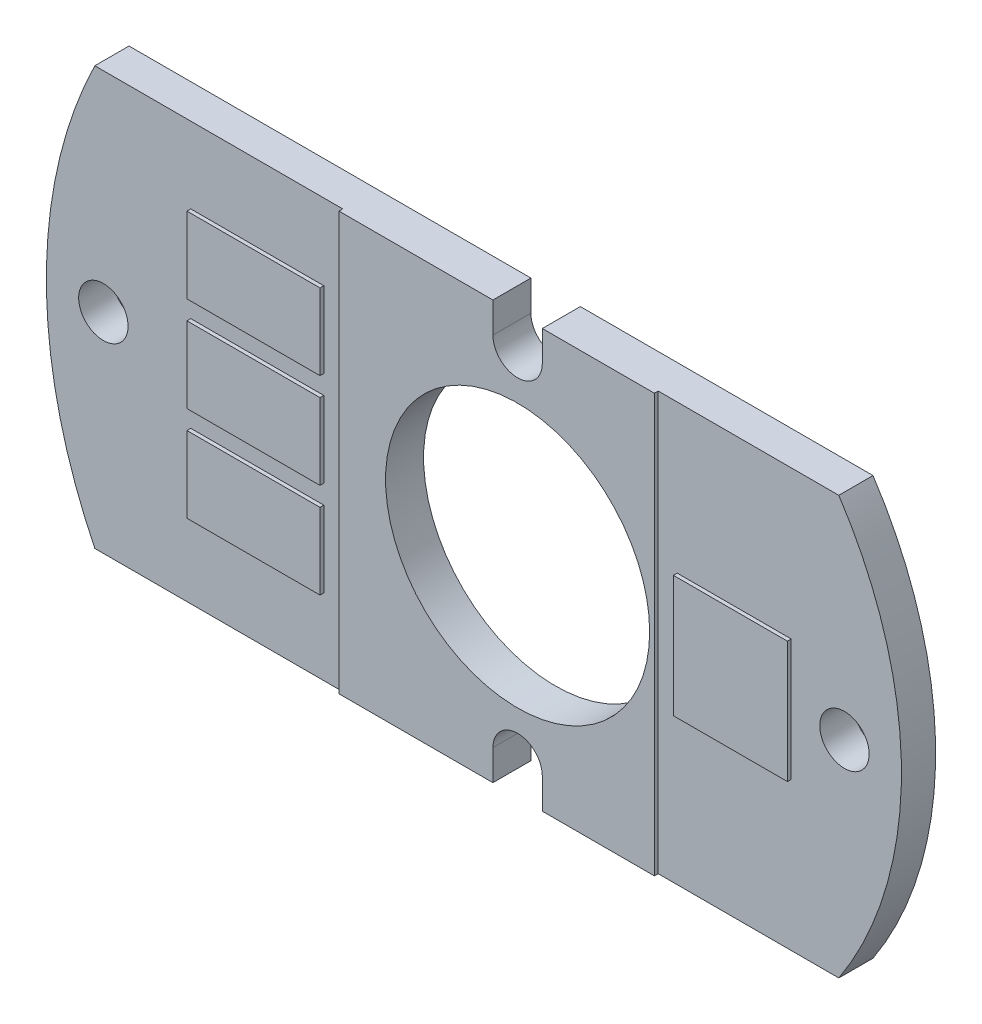
from build123d import *

# Parameters (mm, degrees)
MODEL_R             = 0.65
MODEL_R_2           = 3.4746057
EXTRUDE_1_DEPTH     = 0.5
EXTRUDE2_START      = -0.1
SKETCH2_R           = 0.65
SKETCH2_W           = 3.5
SKETCH2_H           = 2
EXTRUDE2_DEPTH      = 0.1
EXTRUDE1_DEPTH      = 1292.833655824
EXTRUDE1_DEPTH_BACK = 1292.833655824


with BuildPart() as part:
    # Model → Бобышка-Вытянуть1 (new, symmetric)
    with BuildSketch(Plane.XY):
        with BuildLine():
            ThreePointArc((1025.68859, -762.8000398), (1025.03859, -763.4500398), (1024.38859, -762.8000398))
            Line((1024.38859, -762.8000398), (1024.38859, -762.0000398))
            Line((1024.38859, -762.0000398), (1012.53859, -762.0000398))
            Line((1012.53859, -762.0000398), (1012.53859, -773.0000398))
            Line((1012.53859, -773.0000398), (1024.38859, -773.0000398))
            Line((1024.38859, -773.0000398), (1024.38859, -772.2000398))
            ThreePointArc((1024.38859, -772.2000398), (1025.03859, -771.5500398), (1025.68859, -772.2000398))
            Line((1025.68859, -772.2000398), (1025.68859, -773.0000398))
            Line((1025.68859, -773.0000398), (1035.03859, -773.0000398))
            Line((1035.03859, -773.0000398), (1035.03859, -762.0000398))
            Line((1035.03859, -762.0000398), (1025.68859, -762.0000398))
            Line((1025.68859, -762.0000398), (1025.68859, -762.8000398))
        make_face()
        with Locations((1014.03859, -767.5000398)):
            Circle(MODEL_R, mode=Mode.SUBTRACT)
        with Locations((1025.03859, -767.5000398)):
            Circle(MODEL_R_2, mode=Mode.SUBTRACT)
        with Locations((1033.53859, -767.5000398)):
            Circle(MODEL_R, mode=Mode.SUBTRACT)
    extrude(amount=EXTRUDE_1_DEPTH, both=True)

    # Sketch2 → Extrude2 (cut)
    # profile 1 of 2: a face of its own
    with BuildSketch(Plane.XY.offset(0.5).offset(EXTRUDE2_START)):
        Polygon((1035.03859, -762.0000398), (1028.63859, -762.0000398), (1028.63859, -767.5000398), (1028.63859, -773.0000398), (1035.03859, -773.0000398), align=None)
        with Locations((1033.53859, -767.5000398)):
            Circle(SKETCH2_R, mode=Mode.SUBTRACT)
        Polygon((1029.13859, -769.1000398), (1029.13859, -767.5000398), (1029.13859, -765.9000398), (1032.13859, -765.9000398), (1032.13859, -769.1000398), align=None, mode=Mode.SUBTRACT)
    # profile 2 of 2: a face of its own
    with BuildSketch(Plane.XY.offset(0.5).offset(EXTRUDE2_START)):
        Polygon((1019.83859, -760.837037211), (1016.03859, -760.614007836), (1011.640453928, -760.614007836), (1011.640453928, -774.386071764), (1016.03859, -774.386071764), (1019.83859, -774.163042389), (1020.33859, -774.163042389), (1020.33859, -773.0000398), (1020.33859, -762.0000398), (1020.33859, -760.837037211), align=None)
        with Locations((1014.03859, -767.5000398)):
            Circle(SKETCH2_R, mode=Mode.SUBTRACT)
        with Locations((1018.08859, -770.0000398)):
            Rectangle(SKETCH2_W, SKETCH2_H, mode=Mode.SUBTRACT)
        with Locations((1018.08859, -767.5000398)):
            Rectangle(SKETCH2_W, SKETCH2_H, mode=Mode.SUBTRACT)
        with Locations((1018.08859, -765.0000398)):
            Rectangle(SKETCH2_W, SKETCH2_H, mode=Mode.SUBTRACT)
    extrude(amount=EXTRUDE2_DEPTH, mode=Mode.SUBTRACT)

    # Sketch1 → Extrude1 (cut, two sides: drawn at the far end of the back side and taken through both)
    with BuildSketch(Plane.XY.offset(-EXTRUDE1_DEPTH_BACK)):
        with BuildLine():
            Line((1015.958706582, -757.634775328), (1007.064085305, -757.634775328))
            Line((1007.064085305, -757.634775328), (1007.064085305, -780.012512986))
            Line((1007.064085305, -780.012512986), (1015.958706582, -780.012512986))
            Line((1015.958706582, -780.012512986), (1015.958706582, -776.091065182))
            ThreePointArc((1015.958706582, -776.091065182), (1012.53859, -767.5000398), (1015.958706582, -758.909014418))
            Line((1015.958706582, -758.909014418), (1015.958706582, -757.634775328))
        make_face()
        with BuildLine():
            Line((1032.110380671, -777.293143452), (1040.5346574, -777.293143452))
            Line((1040.5346574, -777.293143452), (1040.5346574, -759.185146629))
            Line((1040.5346574, -759.185146629), (1032.110380671, -759.185146629))
            Line((1032.110380671, -759.185146629), (1032.110380671, -760.429694921))
            ThreePointArc((1032.110380671, -760.429694921), (1035.03859, -767.5000398), (1032.110380671, -774.570384679))
            Line((1032.110380671, -774.570384679), (1032.110380671, -777.293143452))
        make_face()
    extrude(amount=EXTRUDE1_DEPTH + EXTRUDE1_DEPTH_BACK, mode=Mode.SUBTRACT)


solid = part.part
